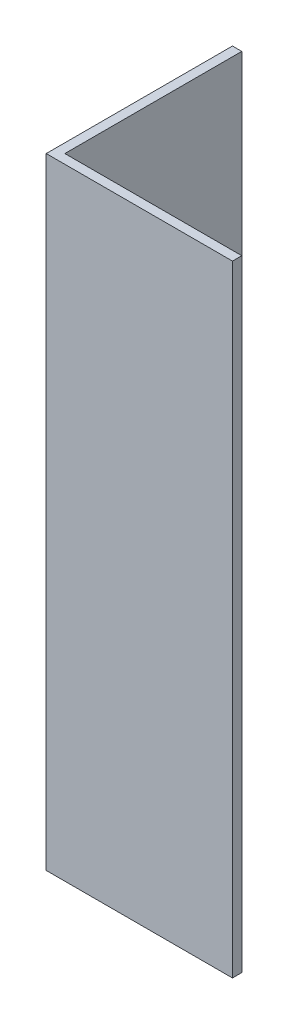
from build123d import *

# Parameters (mm, degrees)
EXTRUDE_1_DEPTH = 50


with BuildPart() as part:
    # Эскиз1 → Бобышка-Вытянуть1 (new body)
    with BuildSketch(Plane(origin=(0, 0, 0), x_dir=(1, 0, 0), z_dir=(0, 1, 0))):
        Polygon((0, 0), (0, 15), (0.75, 15), (0.75, 0.75), (15, 0.75), (15, 0), align=None)
    extrude(amount=EXTRUDE_1_DEPTH)


solid = part.part
